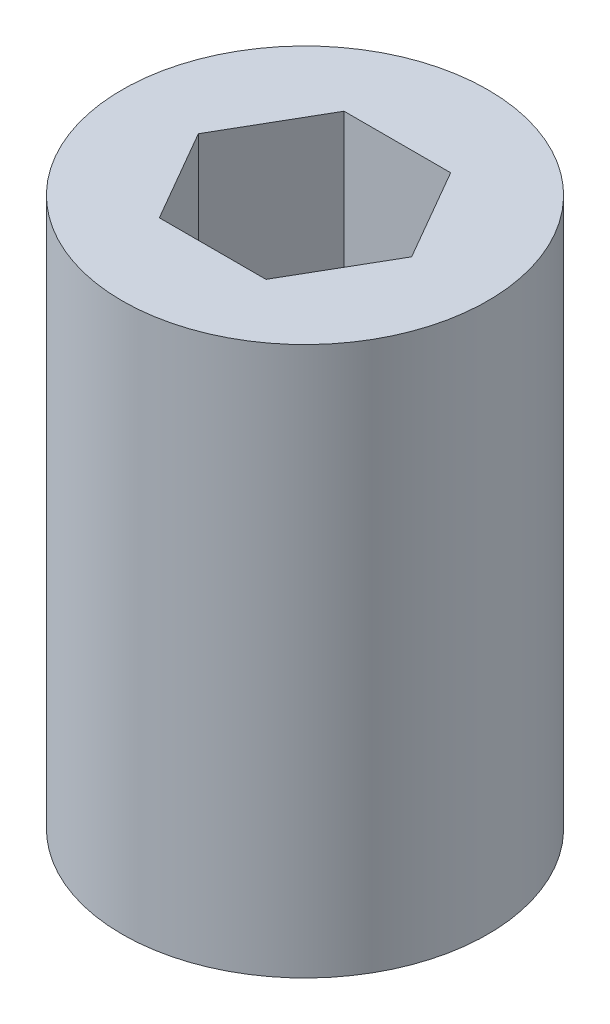
from build123d import *

# Parameters (mm, degrees)
SKETCH1_R           = 12.7
BOSS_EXTRUDE1_DEPTH = 38.1
CUT_EXTRUDE1_DEPTH  = 43.121134838


with BuildPart() as part:
    # Sketch1 → Boss-Extrude1 (new body)
    with BuildSketch(Plane(origin=(0, 0, 0), x_dir=(1, 0, 0), z_dir=(0, 1, 0))):
        Circle(SKETCH1_R)
    extrude(amount=BOSS_EXTRUDE1_DEPTH)

    # Sketch5 → Cut-Extrude1 (cut, through all)
    with BuildSketch(Plane(origin=(0, 0, 0), x_dir=(-1, 0, 0), z_dir=(0, -1, 0))):
        Polygon((-7.405671903, 0), (-3.702835951, -6.4135), (3.702835951, -6.4135), (7.405671903, 0), (3.702835951, 6.4135), (-3.702835951, 6.4135), align=None)
    extrude(amount=-CUT_EXTRUDE1_DEPTH, mode=Mode.SUBTRACT)


solid = part.part
